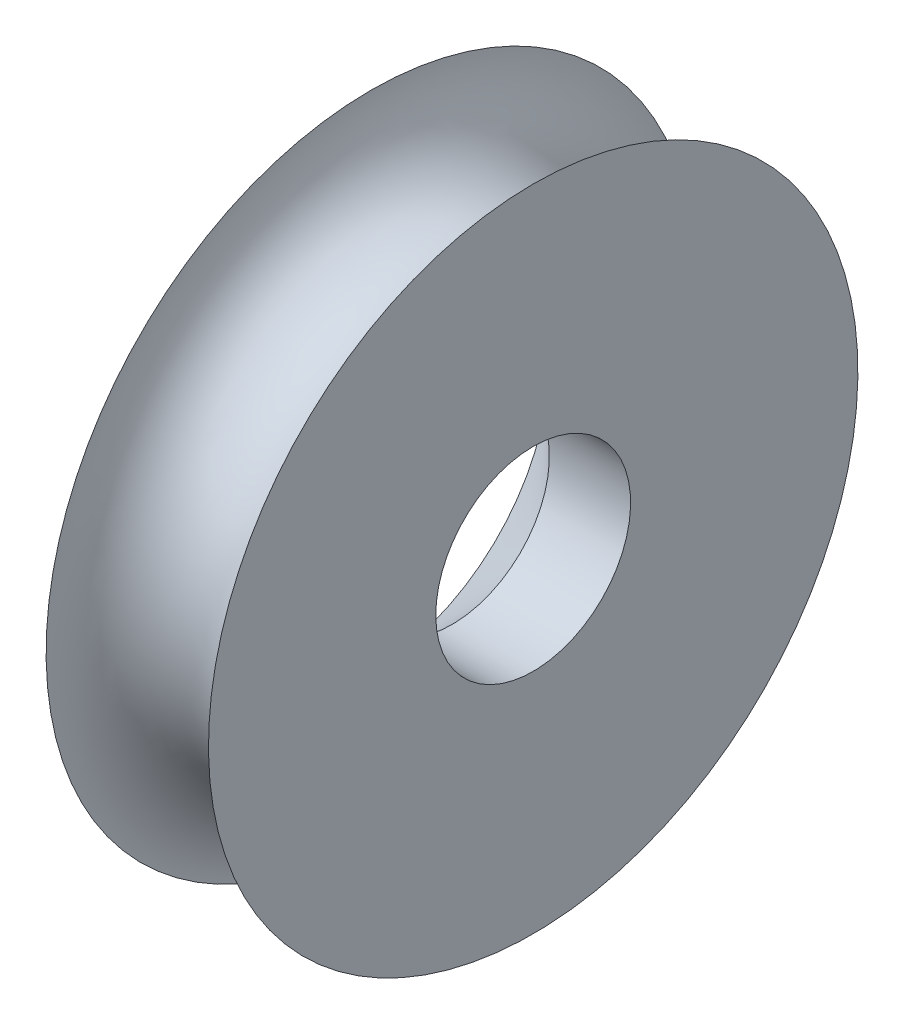
from build123d import *

# Parameters (mm, degrees)
FORMSENKUNG_F_R_M2_LINSENSENKSCHRAUBE_MI_D           = 2.4
FORMSENKUNG_F_R_M2_LINSENSENKSCHRAUBE_MI_DEPTH       = 5
FORMSENKUNG_F_R_M2_LINSENSENKSCHRAUBE_MI_CSINK_D     = 4.4
FORMSENKUNG_F_R_M2_LINSENSENKSCHRAUBE_MI_CSINK_ANGLE = 90
FORMSENKUNG_F_R_M2_LINSENSENKSCHRAUBE_MI_TIP         = 0.721032743


with BuildPart() as part:
    # Skizze1 → Rotation1 (revolve)
    with BuildSketch(Plane.XY):
        with BuildLine():
            Line((0, 0), (0, 4))
            ThreePointArc((0, 4), (-1, 3), (-2, 4))
            Line((-2, 4), (-2, 0))
            Line((-2, 0), (0, 0))
        make_face()
    revolve(axis=Axis((0, 0, 0), (-1, 0, 0)))

    # Formsenkung für M2 Linsensenkschraube mit Schlitz1
    with Locations(Plane.ZY.offset(2)):
        with Locations((0, 0)):
            CounterSinkHole(FORMSENKUNG_F_R_M2_LINSENSENKSCHRAUBE_MI_D / 2, FORMSENKUNG_F_R_M2_LINSENSENKSCHRAUBE_MI_CSINK_D / 2, depth=FORMSENKUNG_F_R_M2_LINSENSENKSCHRAUBE_MI_DEPTH, counter_sink_angle=FORMSENKUNG_F_R_M2_LINSENSENKSCHRAUBE_MI_CSINK_ANGLE)
            with Locations((0, 0, -(FORMSENKUNG_F_R_M2_LINSENSENKSCHRAUBE_MI_DEPTH + FORMSENKUNG_F_R_M2_LINSENSENKSCHRAUBE_MI_TIP / 2))):  # 118° drill point
                Cone(0, FORMSENKUNG_F_R_M2_LINSENSENKSCHRAUBE_MI_D / 2, FORMSENKUNG_F_R_M2_LINSENSENKSCHRAUBE_MI_TIP, mode=Mode.SUBTRACT)


solid = part.part
